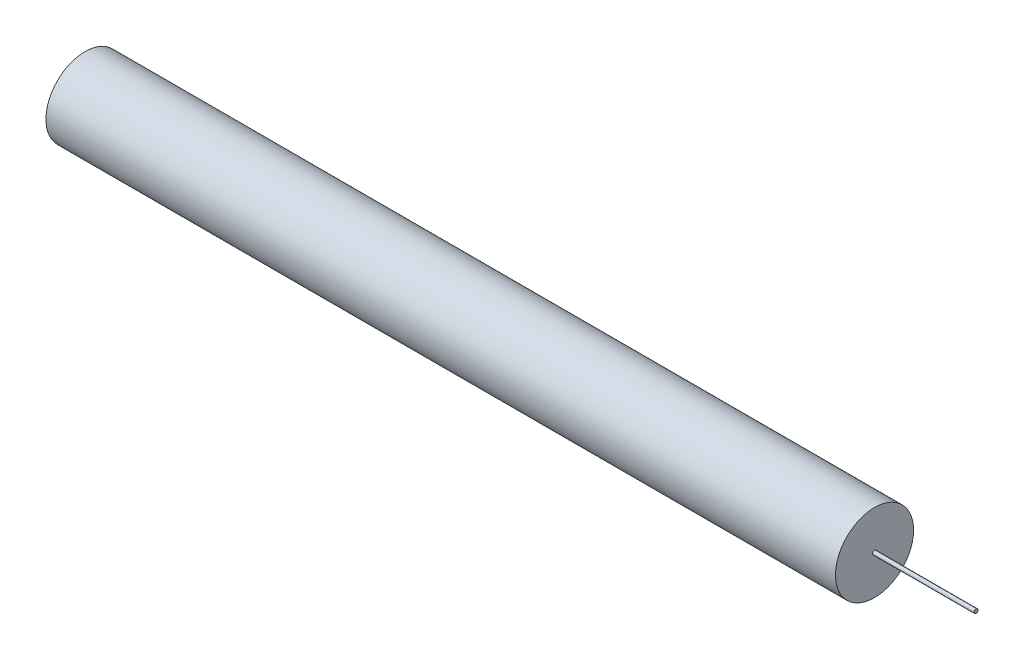
from build123d import *

# Parameters (mm, degrees)
SWEEP1_PROFILE_R = 20
SWEEP2_PROFILE_R = 1


with BuildPart() as part:
    # Sweep1: sweep along a path in Sketch1
    with BuildLine(Plane.XY) as sweep1_path:
        Line((0, 0), (404.357208933, 0))
    # Sweep1 profile (on start of the path) → Sweep1 (sweep)
    with BuildSketch(Plane(origin=(0, 0, 0), x_dir=(0, 0, 1), z_dir=(1, 0, 0))):
        Circle(SWEEP1_PROFILE_R)
    sweep(path=sweep1_path.line)

    # Sweep2: sweep along a path in Sketch16
    with BuildLine(Plane.XY) as sweep2_path:
        Line((456.357208933, 0), (404.357208933, 0))
    # Sweep2 profile (on start of the path) → Sweep2 (sweep)
    with BuildSketch(Plane(origin=(456.357208933, 0, 0), x_dir=(0, -1, 0), z_dir=(-1, 0, 0))):
        Circle(SWEEP2_PROFILE_R)
    sweep(path=sweep2_path.line)


solid = part.part
